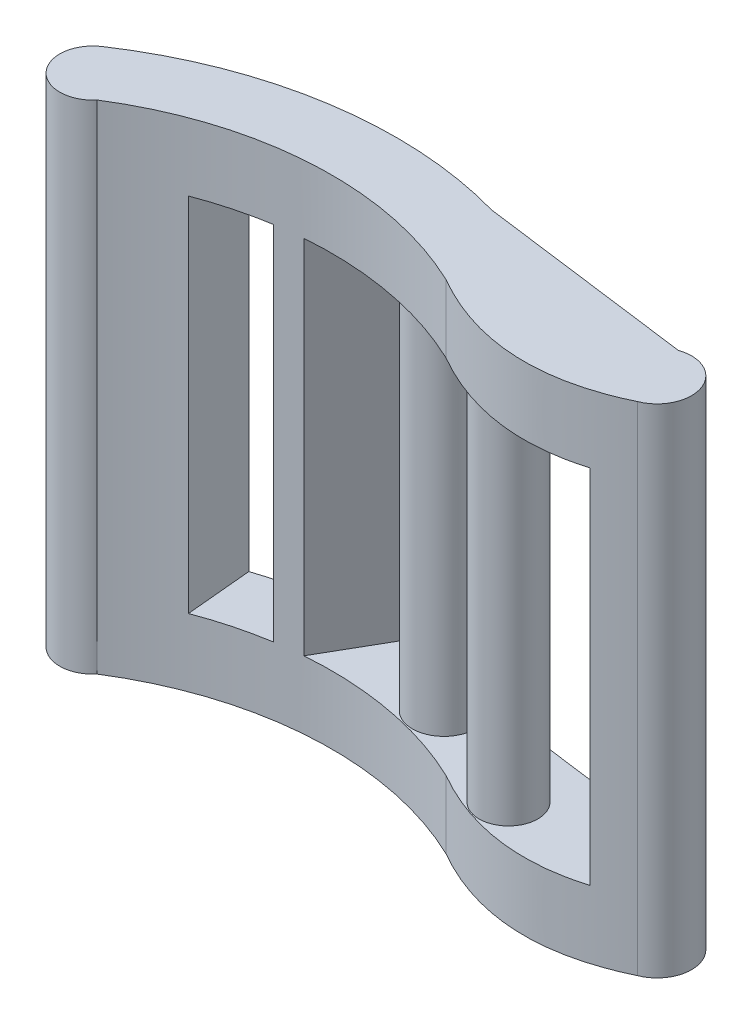
from build123d import *

# Parameters (mm, degrees)
BOSS_EXTRUDE1_DEPTH = 7.5
SKETCH2_R           = 3.25
SKETCH2_R_2         = 3.5
BOSS_EXTRUDE2_DEPTH = 20


with BuildPart() as part:
    # Sketch1 → Boss-Extrude1 (new body)
    with BuildSketch(Plane(origin=(0, 0, 0), x_dir=(1, 0, 0), z_dir=(0, 1, 0))):
        with BuildLine():
            Line((35.982083732, 2.76039509), (12.200865077, 5.886505867))
            ThreePointArc((12.200865077, 5.886505867), (-7.043947865, 7.01553435), (-25, 0))
            ThreePointArc((-25, 0), (-25.695348125, -5.498674822), (-20.153722841, -5.402119003))
            ThreePointArc((-20.153722841, -5.402119003), (-2.181857594, 0.337626859), (16.330643376, -3.298295425))
            add(Edge.make_bspline(
                [(16.330643376, -3.298295425), (27.522025435, -9.773618997), (38.640316478, -4.398221432)],
                knots=[0, 0, 0, 1, 1, 1], degree=2))
            ThreePointArc((38.640316478, -4.398221432), (40.81900496, 0.483651606), (35.982083732, 2.76039509))
        make_face()
    extrude(amount=BOSS_EXTRUDE1_DEPTH)

    # Sketch2 → Boss-Extrude2 (add)
    with BuildSketch(Plane(origin=(0, 7.5, 0), x_dir=(1, 0, 0), z_dir=(0, 1, 0))):
        with BuildLine():
            Line((-13.402084828, -2.048192837), (-14.081748872, 5.313016113))
            ThreePointArc((-14.081748872, 5.313016113), (-19.720618874, 3.025882979), (-25, 0))
            ThreePointArc((-25, 0), (-25.695348125, -5.498674822), (-20.153722841, -5.402119003))
            ThreePointArc((-20.153722841, -5.402119003), (-16.861502373, -3.55686746), (-13.402084828, -2.048192837))
        make_face()
        with BuildLine():
            ThreePointArc((1.221597853, 7.552832305), (-4.465676944, 7.347605615), (-10.081748872, 6.427307449))
            Line((-10.081748872, 6.427307449), (-5.964450017, -0.071777428))
            ThreePointArc((-5.964450017, -0.071777428), (-4.468000004, 0.136199129), (-2.964450017, 0.284369056))
            Line((-2.964450017, 0.284369056), (1.221597853, 7.552832305))
        make_face()
        with BuildLine():
            Line((35.982083732, 2.76039509), (29.063901383, 3.669810403))
            Line((29.063901383, 3.669810403), (34.845333782, -5.887186858))
            add(Edge.make_bspline(
                [(34.845333782, -5.887186858), (36.743888369, -5.315093908), (38.640316478, -4.398221432)],
                knots=[0.82943169, 0.82943169, 0.82943169, 1, 1, 1], degree=2))
            ThreePointArc((38.640316478, -4.398221432), (40.81900496, 0.483651606), (35.982083732, 2.76039509))
        make_face()
        with Locations((22.359210494, -2.405236722)):
            Circle(SKETCH2_R)
        with Locations((10.033702714, 2.785934138)):
            Circle(SKETCH2_R_2)
    extrude(amount=BOSS_EXTRUDE2_DEPTH)

    # Mirror2: part across plane


with BuildPart() as part_1:
    add(part.part)
    add(part.part.mirror(Plane.ZX.offset(27.5)))


solid = part_1.part
